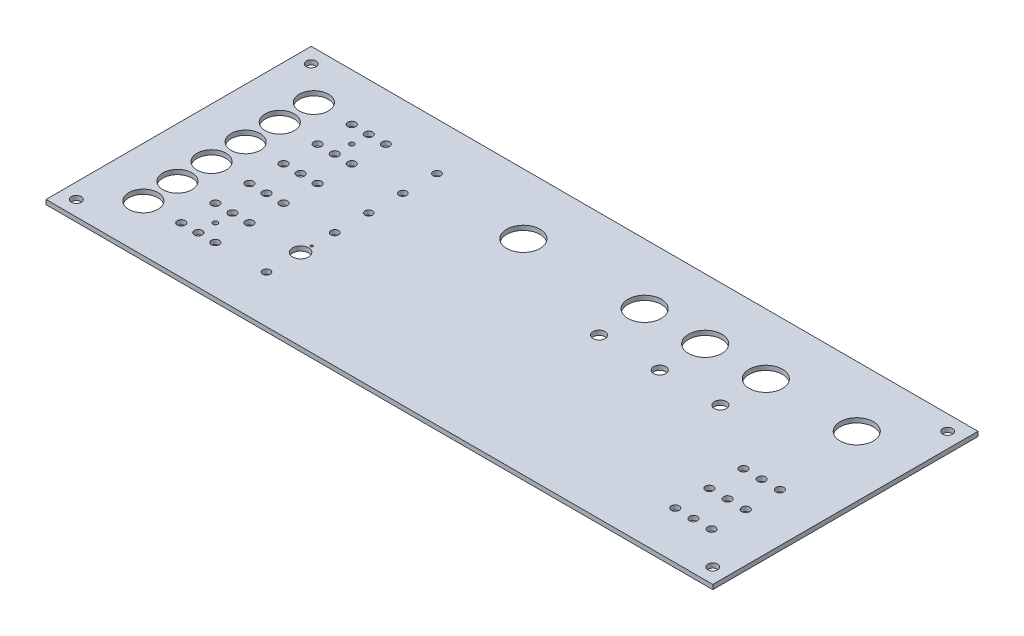
from build123d import *

# Parameters (mm, degrees)
SKETCH1_W           = 440
SKETCH1_H           = 175
SKETCH1_R           = 3.25
SKETCH1_R_2         = 9.6
SKETCH1_R_3         = 2.6
SKETCH1_R_4         = 11
SKETCH1_R_5         = 2.5
SKETCH1_R_6         = 5.25
SKETCH1_R_7         = 0.8
SKETCH1_R_8         = 1.6
SKETCH1_R_9         = 4
BOSS_EXTRUDE1_DEPTH = 3


with BuildPart() as part:
    # Sketch1 → Boss-Extrude1 (new body)
    with BuildSketch(Plane(origin=(0, 0, 0), x_dir=(1, 0, 0), z_dir=(0, 1, 0))):
        with Locations((220, 87.5)):
            Rectangle(SKETCH1_W, SKETCH1_H)
        with Locations((10, 10)):
            Circle(SKETCH1_R, mode=Mode.SUBTRACT)
        with Locations((10, 165)):
            Circle(SKETCH1_R, mode=Mode.SUBTRACT)
        with Locations((430, 165)):
            Circle(SKETCH1_R, mode=Mode.SUBTRACT)
        with Locations((430, 10)):
            Circle(SKETCH1_R, mode=Mode.SUBTRACT)
        with Locations((33, 31.25)):
            Circle(SKETCH1_R_2, mode=Mode.SUBTRACT)
        with Locations((33, 53.75)):
            Circle(SKETCH1_R_2, mode=Mode.SUBTRACT)
        with Locations((33, 76.25)):
            Circle(SKETCH1_R_2, mode=Mode.SUBTRACT)
        with Locations((33, 98.75)):
            Circle(SKETCH1_R_2, mode=Mode.SUBTRACT)
        with Locations((33, 121.25)):
            Circle(SKETCH1_R_2, mode=Mode.SUBTRACT)
        with Locations((33, 143.75)):
            Circle(SKETCH1_R_2, mode=Mode.SUBTRACT)
        with Locations((58, 31.25)):
            Circle(SKETCH1_R_3, mode=Mode.SUBTRACT)
        with Locations((58, 53.75)):
            Circle(SKETCH1_R_3, mode=Mode.SUBTRACT)
        with Locations((58, 76.25)):
            Circle(SKETCH1_R_3, mode=Mode.SUBTRACT)
        with Locations((58, 98.75)):
            Circle(SKETCH1_R_3, mode=Mode.SUBTRACT)
        with Locations((58, 121.25)):
            Circle(SKETCH1_R_3, mode=Mode.SUBTRACT)
        with Locations((58, 143.75)):
            Circle(SKETCH1_R_3, mode=Mode.SUBTRACT)
        with Locations((69.25, 31.25)):
            Circle(SKETCH1_R_3, mode=Mode.SUBTRACT)
        with Locations((69.25, 53.75)):
            Circle(SKETCH1_R_3, mode=Mode.SUBTRACT)
        with Locations((69.25, 76.25)):
            Circle(SKETCH1_R_3, mode=Mode.SUBTRACT)
        with Locations((69.25, 98.75)):
            Circle(SKETCH1_R_3, mode=Mode.SUBTRACT)
        with Locations((69.25, 121.25)):
            Circle(SKETCH1_R_3, mode=Mode.SUBTRACT)
        with Locations((69.25, 143.75)):
            Circle(SKETCH1_R_3, mode=Mode.SUBTRACT)
        with Locations((80.5, 31.25)):
            Circle(SKETCH1_R_3, mode=Mode.SUBTRACT)
        with Locations((80.5, 53.75)):
            Circle(SKETCH1_R_3, mode=Mode.SUBTRACT)
        with Locations((80.5, 76.25)):
            Circle(SKETCH1_R_3, mode=Mode.SUBTRACT)
        with Locations((80.5, 98.75)):
            Circle(SKETCH1_R_3, mode=Mode.SUBTRACT)
        with Locations((80.5, 121.25)):
            Circle(SKETCH1_R_3, mode=Mode.SUBTRACT)
        with Locations((80.5, 143.75)):
            Circle(SKETCH1_R_3, mode=Mode.SUBTRACT)
        with Locations((400, 135)):
            Circle(SKETCH1_R_4, mode=Mode.SUBTRACT)
        with Locations((340, 135)):
            Circle(SKETCH1_R_4, mode=Mode.SUBTRACT)
        with Locations((300, 135)):
            Circle(SKETCH1_R_4, mode=Mode.SUBTRACT)
        with Locations((260, 135)):
            Circle(SKETCH1_R_4, mode=Mode.SUBTRACT)
        with Locations((180, 135)):
            Circle(SKETCH1_R_4, mode=Mode.SUBTRACT)
        with Locations((408, 31.25)):
            Circle(SKETCH1_R_3, mode=Mode.SUBTRACT)
        with Locations((396, 31.25)):
            Circle(SKETCH1_R_3, mode=Mode.SUBTRACT)
        with Locations((384, 31.25)):
            Circle(SKETCH1_R_3, mode=Mode.SUBTRACT)
        with Locations((408, 53.75)):
            Circle(SKETCH1_R_3, mode=Mode.SUBTRACT)
        with Locations((396, 53.75)):
            Circle(SKETCH1_R_3, mode=Mode.SUBTRACT)
        with Locations((384, 53.75)):
            Circle(SKETCH1_R_3, mode=Mode.SUBTRACT)
        with Locations((408, 76.25)):
            Circle(SKETCH1_R_3, mode=Mode.SUBTRACT)
        with Locations((396, 76.25)):
            Circle(SKETCH1_R_3, mode=Mode.SUBTRACT)
        with Locations((384, 76.25)):
            Circle(SKETCH1_R_3, mode=Mode.SUBTRACT)
        with Locations((114.25, 143.75)):
            Circle(SKETCH1_R_5, mode=Mode.SUBTRACT)
        with Locations((114.25, 121.25)):
            Circle(SKETCH1_R_5, mode=Mode.SUBTRACT)
        with Locations((114.25, 98.75)):
            Circle(SKETCH1_R_5, mode=Mode.SUBTRACT)
        with Locations((114.25, 76.25)):
            Circle(SKETCH1_R_5, mode=Mode.SUBTRACT)
        with Locations((114.25, 53.75)):
            Circle(SKETCH1_R_6, mode=Mode.SUBTRACT)
        with Locations((114.25, 31.25)):
            Circle(SKETCH1_R_5, mode=Mode.SUBTRACT)
        with Locations((114.25, 61.17)):
            Circle(SKETCH1_R_7, mode=Mode.SUBTRACT)
        with Locations((69.25, 132.5)):
            Circle(SKETCH1_R_8, mode=Mode.SUBTRACT)
        with Locations((69.25, 42.5)):
            Circle(SKETCH1_R_8, mode=Mode.SUBTRACT)
        with Locations((260, 105)):
            Circle(SKETCH1_R_9, mode=Mode.SUBTRACT)
        with Locations((300, 105)):
            Circle(SKETCH1_R_9, mode=Mode.SUBTRACT)
        with Locations((340, 105)):
            Circle(SKETCH1_R_9, mode=Mode.SUBTRACT)
    extrude(amount=BOSS_EXTRUDE1_DEPTH)


solid = part.part
